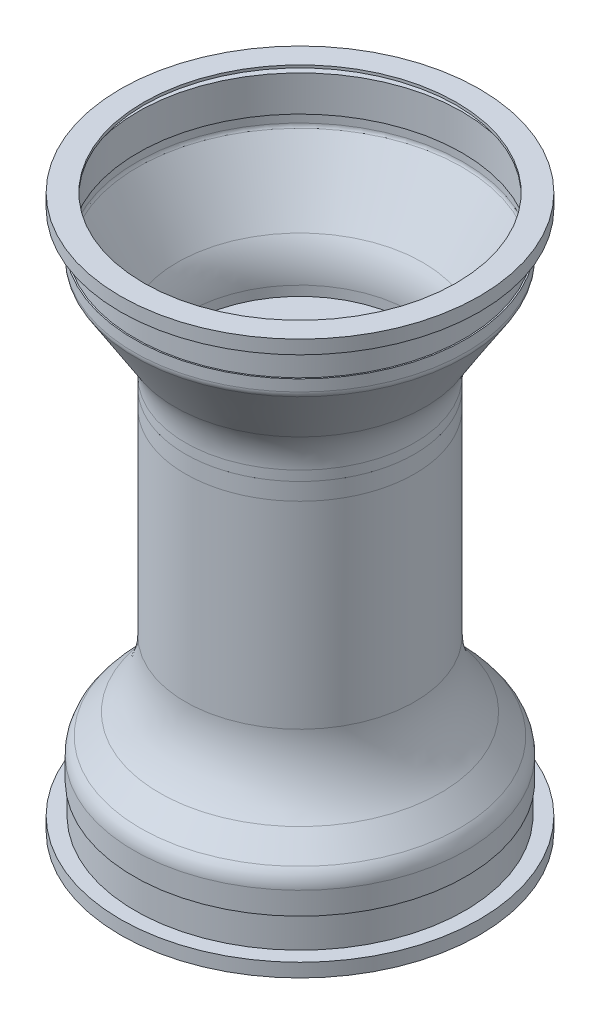
from build123d import *

# Parameters (mm, degrees)
SKETCH8_R               = 59.25
CUT_EXTRUDE4_DEPTH      = 5.5
CUT_EXTRUDE5_START      = -5.5
SKETCH9_R               = 59.25
CUT_EXTRUDE5_DEPTH      = 5.5
SKETCH11_R              = 43.435
BOSS_EXTRUDE1_DEPTH     = 6.5
CUT_EXTRUDE6_DEPTH      = 175.408285354
CUT_EXTRUDE6_DEPTH_BACK = 175.408285354
SKETCH12_R              = 19.84375
CUT_EXTRUDE7_DEPTH      = 175.408285354
CUT_EXTRUDE7_DEPTH_BACK = 175.408285354
SKETCH13_R              = 4.7625


# Read off the part's stored shape, not the designer's step: Shell3
with BuildPart() as part:
    # Sketch1 → Revolve1 (revolve)
    with BuildSketch(Plane.XY, mode=Mode.PRIVATE) as revolve1_sk:
        with BuildLine():
            Line((0, 209.55), (68, 209.55))
            Line((68, 209.55), (68, 204.4))
            Line((68, 204.4), (62.4, 204.4))
            Line((62.4, 204.4), (62.4, 192.9))
            Line((62.4, 192.9), (62.9, 192.9))
            Line((62.9, 192.9), (62.9, 188.6))
            ThreePointArc((62.9, 188.6), (62.755888959, 187.580323047), (62.334844366, 186.640519594))
            Line((62.334844366, 186.640519594), (47.372553847, 162.859973589))
            ThreePointArc((47.372553847, 162.859973589), (44.438305823, 156.31050954), (43.434, 149.204409302))
            Line((43.434, 149.204409302), (43.434, 64.204409302))
            ThreePointArc((43.434, 64.204409302), (45.964317306, 50.780645643), (53.207994273, 39.199234658))
            Line((53.207994273, 39.199234658), (60.495480053, 31.301573198))
            ThreePointArc((60.495480053, 31.301573198), (62.277511561, 28.452407038), (62.9, 25.15))
            Line((62.9, 25.15), (62.9, 16.65))
            Line((62.9, 16.65), (62.4, 16.65))
            Line((62.4, 16.65), (62.4, 5.15))
            Line((62.4, 5.15), (68, 5.15))
            Line((68, 5.15), (68, 0))
            Line((68, 0), (0, 0))
            Line((0, 0), (0, 209.55))
        make_face()
    revolve(revolve1_sk.sketch.rotate(Axis((0, 0, 0), (0, 1, 0)), 90), axis=Axis((0, 0, 0), (0, 1, 0)))

    # Shell3 outline → Shell3 (revolve, cut)
    with BuildSketch(Plane.XY):
        with BuildLine():
            Line((0, 208.55), (0, 1))
            Line((0, 1), (67, 1))
            Line((67, 1), (67, 4.15))
            Line((67, 4.15), (61.4, 4.15))
            Line((61.4, 4.15), (61.4, 17.65))
            Line((61.4, 17.65), (61.9, 17.65))
            Line((61.9, 17.65), (61.9, 25.15))
            ThreePointArc((61.9, 25.15), (61.346134368, 28.088351379), (59.7605531, 30.623426921))
            Line((59.7605531, 30.623426921), (52.47306732, 38.52108838))
            ThreePointArc((52.47306732, 38.52108838), (45.032940112, 50.416589983), (42.434, 64.204409302))
            Line((42.434, 64.204409302), (42.434, 149.204409302))
            ThreePointArc((42.434, 149.204409302), (43.477471904, 156.587634385), (46.526150206, 163.39251549))
            Line((46.526150206, 163.39251549), (61.488440725, 187.173061495))
            ThreePointArc((61.488440725, 187.173061495), (61.79505504, 187.857447892), (61.9, 188.6))
            Line((61.9, 188.6), (61.9, 191.9))
            Line((61.9, 191.9), (61.4, 191.9))
            Line((61.4, 191.9), (61.4, 205.4))
            Line((61.4, 205.4), (67, 205.4))
            Line((67, 205.4), (67, 208.55))
            Line((67, 208.55), (0, 208.55))
        make_face()
    revolve(axis=Axis((0, 0, 0), (0, 1, 0)), mode=Mode.SUBTRACT)

    # Sketch8 → Cut-Extrude4 (cut)
    with BuildSketch(Plane.XZ):
        with Locations(Location((0, 0, 0), (0, 0, 270))):
            Circle(SKETCH8_R)
    extrude(amount=-CUT_EXTRUDE4_DEPTH, mode=Mode.SUBTRACT)

    # Sketch9 → Cut-Extrude5 (cut)
    with BuildSketch(Plane(origin=(0, 209.55, 0), x_dir=(1, 0, 0), z_dir=(0, 1, 0)).offset(CUT_EXTRUDE5_START)):
        with Locations(Location((0, 0, 0), (0, 0, 90))):
            Circle(SKETCH9_R)
    extrude(amount=CUT_EXTRUDE5_DEPTH, mode=Mode.SUBTRACT)

    # Sketch11 → Boss-Extrude1 (add)
    with BuildSketch(Plane(origin=(0, 139, 0), x_dir=(1, 0, 0), z_dir=(0, 1, 0))):
        with Locations(Location((0, 0, 0), (0, 0, 90))):
            Circle(SKETCH11_R)
    extrude(amount=BOSS_EXTRUDE1_DEPTH)

    # Sketch12 → Cut-Extrude6 (cut, two sides: drawn at the far end of the back side and taken through both)
    with BuildSketch(Plane(origin=(0, 145.5, 0), x_dir=(1, 0, 0), z_dir=(0, 1, 0)).offset(-CUT_EXTRUDE6_DEPTH_BACK)):
        with Locations(Location((0, 0, 0), (0, 0, 270))):
            Circle(SKETCH12_R)
    extrude(amount=CUT_EXTRUDE6_DEPTH + CUT_EXTRUDE6_DEPTH_BACK, mode=Mode.SUBTRACT)

    # Sketch13 → Cut-Extrude7 (cut, two sides: drawn at the far end of the back side and taken through both)
    with BuildSketch(Plane(origin=(0, 145.5, 0), x_dir=(1, 0, 0), z_dir=(0, 1, 0)).offset(-CUT_EXTRUDE7_DEPTH_BACK)):
        with Locations(Location((0, 28.575, 0), (0, 0, 270))):
            Circle(SKETCH13_R)
        with Locations(Location((24.746675913, -14.2875, 0), (0, 0, 270))):
            Circle(SKETCH13_R)
        with Locations(Location((-24.746675913, -14.2875, 0), (0, 0, 270))):
            Circle(SKETCH13_R)
    extrude(amount=CUT_EXTRUDE7_DEPTH + CUT_EXTRUDE7_DEPTH_BACK, mode=Mode.SUBTRACT)


solid = part.part
